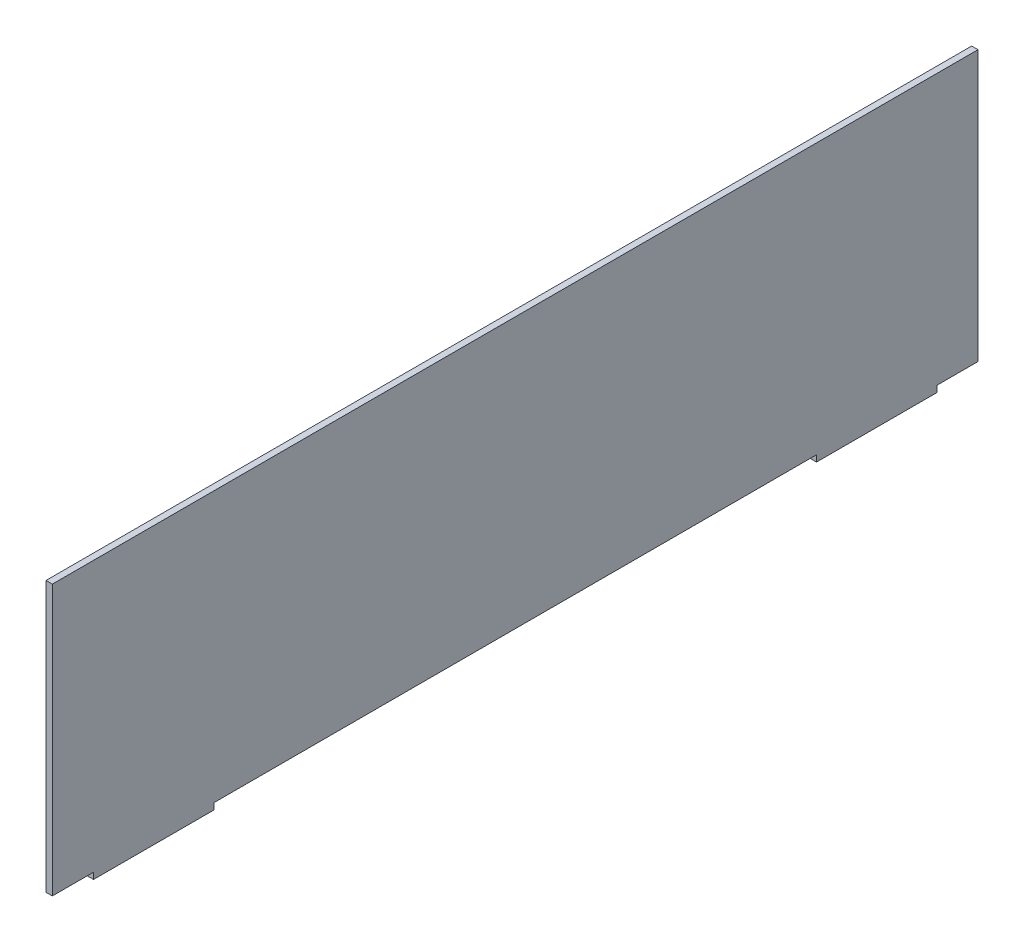
from build123d import *

# Parameters (mm, degrees)
SKETCH1_W           = 464.185
SKETCH1_H           = 135.4455
BASE_FLANGE1_DEPTH  = 3.175
SKETCH2_W           = 60.325
SKETCH2_H           = 3.175
BOSS_EXTRUDE2_DEPTH = 3.175


# Sheet-metal steps are written as plain solids
with BuildPart() as part:
    # Sketch1 → Base-Flange1 (new body)
    with BuildSketch(Plane(origin=(0, 0, 0), x_dir=(0, 0, -1), z_dir=(1, 0, 0))):
        Rectangle(SKETCH1_W, SKETCH1_H)
    extrude(amount=-BASE_FLANGE1_DEPTH)

    # Sketch2 → Boss-Extrude2 (add)
    with BuildSketch(Plane(origin=(0, 0, 0), x_dir=(0, 0, -1), z_dir=(1, 0, 0))):
        with Locations((-181.2925, -69.31025)):
            Rectangle(SKETCH2_W, SKETCH2_H)
        with Locations((181.2925, -69.31025)):
            Rectangle(SKETCH2_W, SKETCH2_H)
    extrude(amount=-BOSS_EXTRUDE2_DEPTH)


solid = part.part
